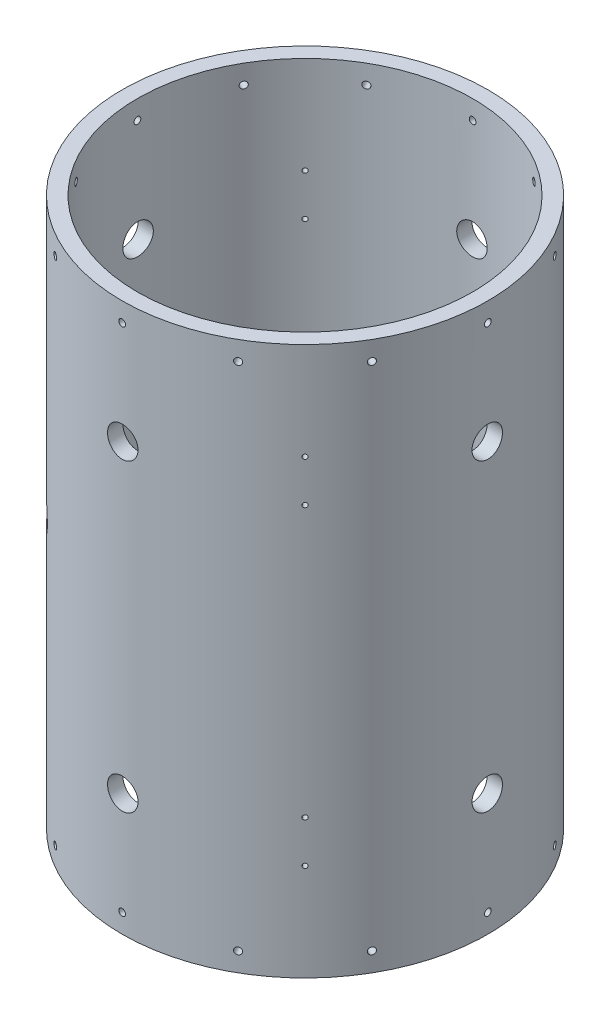
from build123d import *

# Parameters (mm, degrees)
SKETCH1_R                       = 152.4
SKETCH1_R_2                     = 139.7
BOSS_EXTRUDE1_DEPTH             = 457.2
F_10_CLEARANCE_HOLE1_REACH      = 572.229
F_10_CLEARANCE_HOLE1_BORE_R     = 2.8067
CIRPATTERN1_COUNT               = 12
MIRROR1_COPY_1_REACH            = 572.229
MIRROR1_COPY_1_SKETCH_R         = 2.8067
MIRROR1_COPY_2_REACH            = 572.229
MIRROR1_COPY_2_SKETCH_R         = 2.8067
MIRROR1_COPY_3_REACH            = 572.229
MIRROR1_COPY_3_SKETCH_R         = 2.8067
MIRROR1_COPY_4_REACH            = 572.229
MIRROR1_COPY_4_SKETCH_R         = 2.8067
MIRROR1_COPY_5_REACH            = 572.229
MIRROR1_COPY_5_SKETCH_R         = 2.8067
MIRROR1_COPY_6_REACH            = 572.229
MIRROR1_COPY_6_SKETCH_R         = 2.8067
MIRROR1_COPY_7_REACH            = 572.229
MIRROR1_COPY_7_SKETCH_R         = 2.8067
MIRROR1_COPY_8_REACH            = 572.229
MIRROR1_COPY_8_SKETCH_R         = 2.8067
MIRROR1_COPY_9_REACH            = 572.229
MIRROR1_COPY_9_SKETCH_R         = 2.8067
MIRROR1_COPY_10_REACH           = 572.229
MIRROR1_COPY_10_SKETCH_R        = 2.8067
MIRROR1_COPY_11_REACH           = 572.229
MIRROR1_COPY_11_SKETCH_R        = 2.8067
TAP_DRILL_FOR_10_24_TAP1_REACH  = 588.857
TAP_DRILL_FOR_10_24_TAP1_BORE_R = 1.89865
CIRPATTERN2_COUNT               = 2
CUT_EXTRUDE1_REACH              = 572.229
CUT_EXTRUDE1_END_RADIUS         = 139.7
SKETCH7_R                       = 12.7
CIRPATTERN3_COUNT               = 4
MIRROR2_START                   = -152.400000068
MIRROR2_OUTLINE_R               = 12.7
MIRROR2_DEPTH                   = 304.800000136
MIRROR2_2_OUTLINE_R             = 12.7
MIRROR2_2_DEPTH                 = 304.800000136
CUT_EXTRUDE2_REACH              = 588.857
CUT_EXTRUDE2_END_RADIUS         = 139.7
SKETCH8_R                       = 12.7


# Read off the part's stored shape, not the designer's step: Mirror2
with BuildPart() as part:
    # Sketch1 → Boss-Extrude1 (new body)
    with BuildSketch(Plane(origin=(0, 0, 0), x_dir=(1, 0, 0), z_dir=(0, 1, 0))):
        with Locations(Location((0, 0, 0), (0, 0, 270))):
            Circle(SKETCH1_R)
        with Locations(Location((0, 0, 0), (0, 0, 270))):
            Circle(SKETCH1_R_2, mode=Mode.SUBTRACT)
    extrude(amount=BOSS_EXTRUDE1_DEPTH)

    # #10 Clearance Hole1 bore → #10 Clearance Hole1 (cut, up to next)
    with BuildSketch(Plane.ZY.offset(152.4), mode=Mode.PRIVATE) as f_10_clearance_hole1_sk1:
        with Locations((0, 441.325)):
            Circle(F_10_CLEARANCE_HOLE1_BORE_R)
    f_10_clearance_hole1_tool1 = extrude(f_10_clearance_hole1_sk1.sketch, amount=-F_10_CLEARANCE_HOLE1_REACH, mode=Mode.PRIVATE) & part.part
    f_10_clearance_hole1 = f_10_clearance_hole1_tool1.solids().sort_by_distance((-152.4, 441.325, 0))[0]
    add(f_10_clearance_hole1, mode=Mode.SUBTRACT)

    # CirPattern1: #10 Clearance Hole1 ×12 about axis
    cirpattern1_axis = Axis((0, 457.2, 0), (0, -1, 0))
    for i in range(1, CIRPATTERN1_COUNT):
        add(f_10_clearance_hole1.rotate(cirpattern1_axis, i * 360 / CIRPATTERN1_COUNT), mode=Mode.SUBTRACT)

    # Mirror1: #10 Clearance Hole1 across plane
    add(f_10_clearance_hole1.mirror(Plane.ZX.offset(228.6)), mode=Mode.SUBTRACT)

    # Mirror1 copy 1 sketch → Mirror1 copy 1 (cut, up to next)
    with BuildSketch(Plane(origin=(-131.982271537, 457.2, -76.2), x_dir=(-0.49999999999999994, 0, 0.8660254037844387), z_dir=(-0.8660254037844387, 0, -0.49999999999999994)), mode=Mode.PRIVATE) as mirror1_copy_1_sk1:
        with Locations((0, -441.325)):
            Circle(MIRROR1_COPY_1_SKETCH_R)
    mirror1_copy_1_tool1 = extrude(mirror1_copy_1_sk1.sketch, amount=-MIRROR1_COPY_1_REACH, mode=Mode.PRIVATE) & part.part
    add(mirror1_copy_1_tool1.solids().sort_by_distance((-131.982271537, 15.875, -76.2))[0], mode=Mode.SUBTRACT)

    # Mirror1 copy 2 sketch → Mirror1 copy 2 (cut, up to next)
    with BuildSketch(Plane(origin=(-76.2, 457.2, -131.982271537), x_dir=(-0.8660254037844386, 0, 0.5000000000000001), z_dir=(-0.5000000000000001, 0, -0.8660254037844386)), mode=Mode.PRIVATE) as mirror1_copy_2_sk1:
        with Locations((0, -441.325)):
            Circle(MIRROR1_COPY_2_SKETCH_R)
    mirror1_copy_2_tool1 = extrude(mirror1_copy_2_sk1.sketch, amount=-MIRROR1_COPY_2_REACH, mode=Mode.PRIVATE) & part.part
    add(mirror1_copy_2_tool1.solids().sort_by_distance((-76.2, 15.875, -131.982271537))[0], mode=Mode.SUBTRACT)

    # Mirror1 copy 3 sketch → Mirror1 copy 3 (cut, up to next)
    with BuildSketch(Plane(origin=(0, 457.2, -152.4), x_dir=(-1, 0, 0), z_dir=(0, 0, -1)), mode=Mode.PRIVATE) as mirror1_copy_3_sk1:
        with Locations((0, -441.325)):
            Circle(MIRROR1_COPY_3_SKETCH_R)
    mirror1_copy_3_tool1 = extrude(mirror1_copy_3_sk1.sketch, amount=-MIRROR1_COPY_3_REACH, mode=Mode.PRIVATE) & part.part
    add(mirror1_copy_3_tool1.solids().sort_by_distance((0, 15.875, -152.4))[0], mode=Mode.SUBTRACT)

    # Mirror1 copy 4 sketch → Mirror1 copy 4 (cut, up to next)
    with BuildSketch(Plane(origin=(76.2, 457.2, -131.982271537), x_dir=(-0.8660254037844387, 0, -0.4999999999999998), z_dir=(0.4999999999999998, 0, -0.8660254037844387)), mode=Mode.PRIVATE) as mirror1_copy_4_sk1:
        with Locations((0, -441.325)):
            Circle(MIRROR1_COPY_4_SKETCH_R)
    mirror1_copy_4_tool1 = extrude(mirror1_copy_4_sk1.sketch, amount=-MIRROR1_COPY_4_REACH, mode=Mode.PRIVATE) & part.part
    add(mirror1_copy_4_tool1.solids().sort_by_distance((76.2, 15.875, -131.982271537))[0], mode=Mode.SUBTRACT)

    # Mirror1 copy 5 sketch → Mirror1 copy 5 (cut, up to next)
    with BuildSketch(Plane(origin=(131.982271537, 457.2, -76.2), x_dir=(-0.49999999999999994, 0, -0.8660254037844387), z_dir=(0.8660254037844387, 0, -0.49999999999999994)), mode=Mode.PRIVATE) as mirror1_copy_5_sk1:
        with Locations((0, -441.325)):
            Circle(MIRROR1_COPY_5_SKETCH_R)
    mirror1_copy_5_tool1 = extrude(mirror1_copy_5_sk1.sketch, amount=-MIRROR1_COPY_5_REACH, mode=Mode.PRIVATE) & part.part
    add(mirror1_copy_5_tool1.solids().sort_by_distance((131.982271537, 15.875, -76.2))[0], mode=Mode.SUBTRACT)

    # Mirror1 copy 6 sketch → Mirror1 copy 6 (cut, up to next)
    with BuildSketch(Plane(origin=(152.4, 457.2, 0), x_dir=(0, 0, -1), z_dir=(1, 0, 0)), mode=Mode.PRIVATE) as mirror1_copy_6_sk1:
        with Locations((0, -441.325)):
            Circle(MIRROR1_COPY_6_SKETCH_R)
    mirror1_copy_6_tool1 = extrude(mirror1_copy_6_sk1.sketch, amount=-MIRROR1_COPY_6_REACH, mode=Mode.PRIVATE) & part.part
    add(mirror1_copy_6_tool1.solids().sort_by_distance((152.4, 15.875, 0))[0], mode=Mode.SUBTRACT)

    # Mirror1 copy 7 sketch → Mirror1 copy 7 (cut, up to next)
    with BuildSketch(Plane(origin=(131.982271537, 457.2, 76.2), x_dir=(0.5000000000000001, 0, -0.8660254037844386), z_dir=(0.8660254037844386, 0, 0.5000000000000001)), mode=Mode.PRIVATE) as mirror1_copy_7_sk1:
        with Locations((0, -441.325)):
            Circle(MIRROR1_COPY_7_SKETCH_R)
    mirror1_copy_7_tool1 = extrude(mirror1_copy_7_sk1.sketch, amount=-MIRROR1_COPY_7_REACH, mode=Mode.PRIVATE) & part.part
    add(mirror1_copy_7_tool1.solids().sort_by_distance((131.982271537, 15.875, 76.2))[0], mode=Mode.SUBTRACT)

    # Mirror1 copy 8 sketch → Mirror1 copy 8 (cut, up to next)
    with BuildSketch(Plane(origin=(76.2, 457.2, 131.982271537), x_dir=(0.8660254037844384, 0, -0.5000000000000004), z_dir=(0.5000000000000004, 0, 0.8660254037844384)), mode=Mode.PRIVATE) as mirror1_copy_8_sk1:
        with Locations((0, -441.325)):
            Circle(MIRROR1_COPY_8_SKETCH_R)
    mirror1_copy_8_tool1 = extrude(mirror1_copy_8_sk1.sketch, amount=-MIRROR1_COPY_8_REACH, mode=Mode.PRIVATE) & part.part
    add(mirror1_copy_8_tool1.solids().sort_by_distance((76.2, 15.875, 131.982271537))[0], mode=Mode.SUBTRACT)

    # Mirror1 copy 9 sketch → Mirror1 copy 9 (cut, up to next)
    with BuildSketch(Plane(origin=(0, 457.2, 152.4), x_dir=(1, 0, 0), z_dir=(0, 0, 1)), mode=Mode.PRIVATE) as mirror1_copy_9_sk1:
        with Locations((0, -441.325)):
            Circle(MIRROR1_COPY_9_SKETCH_R)
    mirror1_copy_9_tool1 = extrude(mirror1_copy_9_sk1.sketch, amount=-MIRROR1_COPY_9_REACH, mode=Mode.PRIVATE) & part.part
    add(mirror1_copy_9_tool1.solids().sort_by_distance((0, 15.875, 152.4))[0], mode=Mode.SUBTRACT)

    # Mirror1 copy 10 sketch → Mirror1 copy 10 (cut, up to next)
    with BuildSketch(Plane(origin=(-76.2, 457.2, 131.982271537), x_dir=(0.8660254037844386, 0, 0.5000000000000001), z_dir=(-0.5000000000000001, 0, 0.8660254037844386)), mode=Mode.PRIVATE) as mirror1_copy_10_sk1:
        with Locations((0, -441.325)):
            Circle(MIRROR1_COPY_10_SKETCH_R)
    mirror1_copy_10_tool1 = extrude(mirror1_copy_10_sk1.sketch, amount=-MIRROR1_COPY_10_REACH, mode=Mode.PRIVATE) & part.part
    add(mirror1_copy_10_tool1.solids().sort_by_distance((-76.2, 15.875, 131.982271537))[0], mode=Mode.SUBTRACT)

    # Mirror1 copy 11 sketch → Mirror1 copy 11 (cut, up to next)
    with BuildSketch(Plane(origin=(-131.982271537, 457.2, 76.2), x_dir=(0.5000000000000004, 0, 0.8660254037844384), z_dir=(-0.8660254037844384, 0, 0.5000000000000004)), mode=Mode.PRIVATE) as mirror1_copy_11_sk1:
        with Locations((0, -441.325)):
            Circle(MIRROR1_COPY_11_SKETCH_R)
    mirror1_copy_11_tool1 = extrude(mirror1_copy_11_sk1.sketch, amount=-MIRROR1_COPY_11_REACH, mode=Mode.PRIVATE) & part.part
    add(mirror1_copy_11_tool1.solids().sort_by_distance((-131.982271537, 15.875, 76.2))[0], mode=Mode.SUBTRACT)

    # Tap Drill for #10-24 Tap1 bore → Tap Drill for #10-24 Tap1 (cut, up to next)
    with BuildSketch(Plane(origin=(-107.763073453, 0, -107.763073453), x_dir=(0, -1, 0), z_dir=(-0.7071067811865464, 0, -0.7071067811865488)), mode=Mode.PRIVATE) as tap_drill_for_10_24_tap1_sk1:
        with Locations((-376.2375, 0)):
            Circle(TAP_DRILL_FOR_10_24_TAP1_BORE_R)
    tap_drill_for_10_24_tap1_tool1 = extrude(tap_drill_for_10_24_tap1_sk1.sketch, amount=-TAP_DRILL_FOR_10_24_TAP1_REACH, mode=Mode.PRIVATE) & part.part
    # Tap Drill for #10-24 Tap1 bore → Tap Drill for #10-24 Tap1 (cut, up to next)
    with BuildSketch(Plane(origin=(-107.763073453, 0, -107.763073453), x_dir=(0, -1, 0), z_dir=(-0.7071067811865464, 0, -0.7071067811865488)), mode=Mode.PRIVATE) as tap_drill_for_10_24_tap1_sk2:
        with Locations((-341.3125, 0)):
            Circle(TAP_DRILL_FOR_10_24_TAP1_BORE_R)
    tap_drill_for_10_24_tap1_tool2 = extrude(tap_drill_for_10_24_tap1_sk2.sketch, amount=-TAP_DRILL_FOR_10_24_TAP1_REACH, mode=Mode.PRIVATE) & part.part
    # Tap Drill for #10-24 Tap1 bore → Tap Drill for #10-24 Tap1 (cut, up to next)
    with BuildSketch(Plane(origin=(-107.763073453, 0, -107.763073453), x_dir=(0, -1, 0), z_dir=(-0.7071067811865464, 0, -0.7071067811865488)), mode=Mode.PRIVATE) as tap_drill_for_10_24_tap1_sk3:
        with Locations((-80.9625, 0)):
            Circle(TAP_DRILL_FOR_10_24_TAP1_BORE_R)
    tap_drill_for_10_24_tap1_tool3 = extrude(tap_drill_for_10_24_tap1_sk3.sketch, amount=-TAP_DRILL_FOR_10_24_TAP1_REACH, mode=Mode.PRIVATE) & part.part
    # Tap Drill for #10-24 Tap1 bore → Tap Drill for #10-24 Tap1 (cut, up to next)
    with BuildSketch(Plane(origin=(-107.763073453, 0, -107.763073453), x_dir=(0, -1, 0), z_dir=(-0.7071067811865464, 0, -0.7071067811865488)), mode=Mode.PRIVATE) as tap_drill_for_10_24_tap1_sk4:
        with Locations((-115.8875, 0)):
            Circle(TAP_DRILL_FOR_10_24_TAP1_BORE_R)
    tap_drill_for_10_24_tap1_tool4 = extrude(tap_drill_for_10_24_tap1_sk4.sketch, amount=-TAP_DRILL_FOR_10_24_TAP1_REACH, mode=Mode.PRIVATE) & part.part
    tap_drill_for_10_24_tap1_1 = tap_drill_for_10_24_tap1_tool1.solids().sort_by_distance((-107.763073, 376.2375, -107.763073))[0]
    add(tap_drill_for_10_24_tap1_1, mode=Mode.SUBTRACT)
    tap_drill_for_10_24_tap1_2 = tap_drill_for_10_24_tap1_tool2.solids().sort_by_distance((-107.763073, 341.3125, -107.763073))[0]
    add(tap_drill_for_10_24_tap1_2, mode=Mode.SUBTRACT)
    tap_drill_for_10_24_tap1_3 = tap_drill_for_10_24_tap1_tool3.solids().sort_by_distance((-107.763073, 80.9625, -107.763073))[0]
    add(tap_drill_for_10_24_tap1_3, mode=Mode.SUBTRACT)
    tap_drill_for_10_24_tap1_4 = tap_drill_for_10_24_tap1_tool4.solids().sort_by_distance((-107.763073, 115.8875, -107.763073))[0]
    add(tap_drill_for_10_24_tap1_4, mode=Mode.SUBTRACT)
    tap_drill_for_10_24_tap1 = tap_drill_for_10_24_tap1_1 + tap_drill_for_10_24_tap1_2 + tap_drill_for_10_24_tap1_3 + tap_drill_for_10_24_tap1_4  # Tap Drill for #10-24 Tap1 as one shape, for the pattern or mirror that repeats it

    # CirPattern2: Tap Drill for #10-24 Tap1 ×2 about axis
    cirpattern2_axis = Axis((0, 457.2, 0), (0, -1, 0))
    for i in range(1, CIRPATTERN2_COUNT):
        add(tap_drill_for_10_24_tap1.rotate(cirpattern2_axis, i * 360 / CIRPATTERN2_COUNT), mode=Mode.SUBTRACT)

    # Cut-Extrude1: up to this cylinder (the profile starts outside it)
    cut_extrude1_end = Plane(origin=(0, 355.6, 0), z_dir=(0, -1, 0)) * Cylinder(CUT_EXTRUDE1_END_RADIUS, 1424.858, mode=Mode.PRIVATE)
    # Sketch7 → Cut-Extrude1 (cut, up to the surface)
    with BuildSketch(Plane.ZY.offset(152.4), mode=Mode.PRIVATE) as cut_extrude1_sk1:
        with Locations((0, 355.6)):
            Circle(SKETCH7_R)
    cut_extrude1_tool1 = extrude(cut_extrude1_sk1.sketch, amount=-CUT_EXTRUDE1_REACH, mode=Mode.PRIVATE) - cut_extrude1_end
    cut_extrude1 = cut_extrude1_tool1.solids().sort_by_distance((-152.4, 355.6, 0))[0]
    add(cut_extrude1, mode=Mode.SUBTRACT)

    # CirPattern3: Cut-Extrude1 ×4 about axis
    cirpattern3_axis = Axis((0, 457.2, 0), (0, -1, 0))
    for i in range(1, CIRPATTERN3_COUNT):
        add(cut_extrude1.rotate(cirpattern3_axis, i * 360 / CIRPATTERN3_COUNT), mode=Mode.SUBTRACT)

    # Mirror2 outline → Mirror2 (cut)
    with BuildSketch(Plane.YZ.offset(MIRROR2_START)):
        with Locations((101.6, 0)):
            Circle(MIRROR2_OUTLINE_R)
    extrude(amount=MIRROR2_DEPTH, mode=Mode.SUBTRACT)

    # Mirror2 2 outline → Mirror2 2 (cut)
    with BuildSketch(Plane.XY.offset(MIRROR2_START)):
        with Locations((0, 101.6)):
            Circle(MIRROR2_2_OUTLINE_R)
    extrude(amount=MIRROR2_2_DEPTH, mode=Mode.SUBTRACT)

    # Cut-Extrude2: up to this cylinder (the profile starts outside it)
    cut_extrude2_end = Plane(origin=(0, 228.6, 0), z_dir=(0, -1, 0)) * Cylinder(CUT_EXTRUDE2_END_RADIUS, 1458.114, mode=Mode.PRIVATE)
    # Sketch8 → Cut-Extrude2 (cut, up to the surface)
    with BuildSketch(Plane(origin=(-107.763073453, 0, 107.763073453), x_dir=(0, -1, 0), z_dir=(-0.7071067811865512, 0, 0.7071067811865438)), mode=Mode.PRIVATE) as cut_extrude2_sk1:
        with Locations(Location((-228.6, 0, 0), (0, 0, 90))):
            Circle(SKETCH8_R)
    cut_extrude2_tool1 = extrude(cut_extrude2_sk1.sketch, amount=-CUT_EXTRUDE2_REACH, mode=Mode.PRIVATE) - cut_extrude2_end
    add(cut_extrude2_tool1.solids().sort_by_distance((-107.763073, 228.6, 107.763073))[0], mode=Mode.SUBTRACT)


solid = part.part
